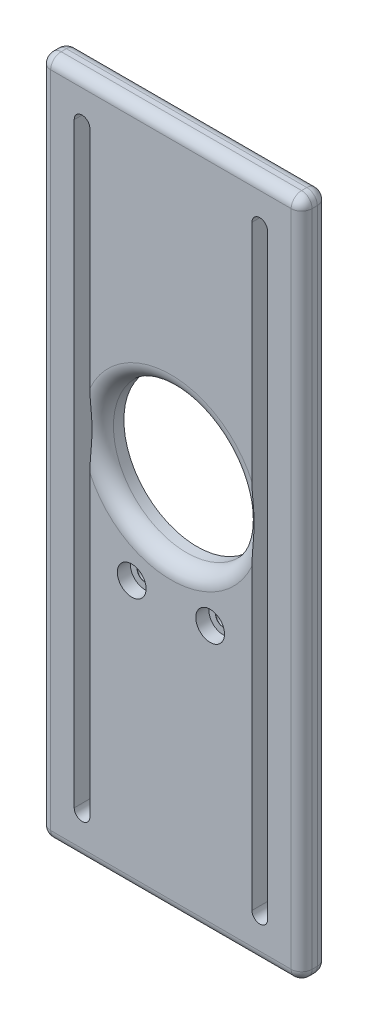
from build123d import *

# Parameters (mm, degrees)
BASE_W                          = 50
BASE_H                          = 130
BASE_R                          = 14
BOSS_EXTRUDE1_DEPTH             = 5
CBORE_FOR_M2_5_SHCS1_AT_2_COUNT = 2
CBORE_FOR_M2_5_SHCS1_AT_2_PITCH = 15
FILLET3_R                       = 2
FILLET5_R                       = 3


with BuildPart() as part:
    # Base → Boss-Extrude1 (new body)
    with BuildSketch(Plane.XY):
        with Locations((28.12242927, 52.845785243)):
            Rectangle(BASE_W, BASE_H)
        with Locations((28.12242927, 59.845785243)):
            Circle(BASE_R, mode=Mode.SUBTRACT)
        with BuildLine():
            Line((46.62242927, 109.845785243), (46.62242927, -4.154214757))
            ThreePointArc((46.62242927, -4.154214757), (45.12242927, -5.654214757), (43.62242927, -4.154214757))
            Line((43.62242927, -4.154214757), (43.62242927, 109.845785243))
            ThreePointArc((43.62242927, 109.845785243), (45.12242927, 111.345785243), (46.62242927, 109.845785243))
        make_face(mode=Mode.SUBTRACT)
        with BuildLine():
            Line((12.62242927, 109.845785243), (12.62242927, -4.154214757))
            ThreePointArc((12.62242927, -4.154214757), (11.12242927, -5.654214757), (9.62242927, -4.154214757))
            Line((9.62242927, -4.154214757), (9.62242927, 109.845785243))
            ThreePointArc((9.62242927, 109.845785243), (11.12242927, 111.345785243), (12.62242927, 109.845785243))
        make_face(mode=Mode.SUBTRACT)
    extrude(amount=BOSS_EXTRUDE1_DEPTH)

    # Sketch5 → CBORE for M2.5 SHCS1 (revolve, cut)
    with BuildSketch(Plane(origin=(20.62242927, 38.995785243, 5), x_dir=(0, -1, 0), z_dir=(1, 0, 0))):
        Polygon((0, 0), (0, 5), (1.45, 5), (1.45, 2.525), (1.475, 2.5), (2.75, 2.5), (2.75, 0), align=None)
    cbore_for_m2_5_shcs1 = revolve(axis=Axis((20.62242927, 38.995785243, 11.35), (0, 0, -1)), mode=Mode.SUBTRACT)

    # CBORE for M2.5 SHCS1 at 2: CBORE for M2.5 SHCS1 ×2
    with Locations(*[(i * CBORE_FOR_M2_5_SHCS1_AT_2_PITCH, 0, 0) for i in range(1, CBORE_FOR_M2_5_SHCS1_AT_2_COUNT)]):
        add(cbore_for_m2_5_shcs1, mode=Mode.SUBTRACT)

    # Fillet3
    fillet3_edges = [part.edges().sort_by_distance(p)[0] for p in [
        (53.12242927, 52.845785243, 5),
        (28.12242927, 117.845785243, 5),
        (3.12242927, 52.845785243, 5),
        (28.12242927, 117.845785243, 0),
        (53.12242927, 52.845785243, 0),
        (28.12242927, -12.154214757, 0),
        (3.12242927, 52.845785243, 0),
        (28.12242927, -12.154214757, 5),
        (3.12242927, 117.845785243, 2.5),
        (53.12242927, 117.845785243, 2.5),
        (53.12242927, -12.154214757, 2.5),
        (3.12242927, -12.154214757, 2.5),
    ]]
    fillet(fillet3_edges, radius=FILLET3_R)

    # Fillet5
    # the kernel refuses this fillet: 3 mm, written as the material it takes off along each edge
    with BuildSketch(Plane(origin=(28.12242927, 59.845785243, 5), x_dir=(1, 0, 0), z_dir=(0, -1, 0))) as fillet5_piece_1:
        with BuildLine():
            CenterArc((14 + FILLET5_R, -FILLET5_R), FILLET5_R, 90, 90)
            Line((14, -FILLET5_R), (14, 0))
            Line((14, 0), (14 + FILLET5_R, 0))
        make_face()
    revolve(axis=Axis((28.12242927, 59.845785243, 5), (0, 0, 1)), mode=Mode.SUBTRACT)


solid = part.part
